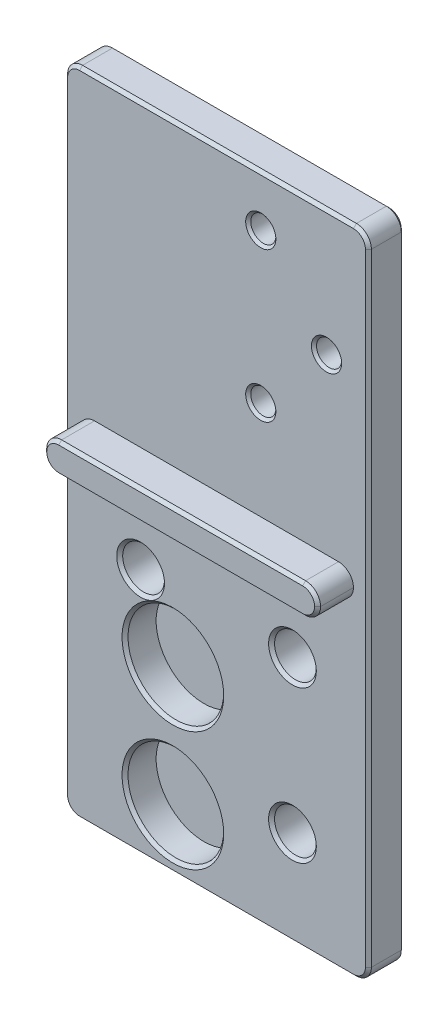
from build123d import *

# Parameters (mm, degrees)
MAIN_FEATURES_SKETCH_W         = 50.8
MAIN_FEATURES_SKETCH_H         = 109
MAIN_FEATURES_SKETCH_R         = 3.4925
MAIN_FEATURES_SKETCH_R_2       = 8
MAIN_BODY_DEPTH                = 6
SKETCH1_5_W                    = 45.8
SKETCH1_5_H                    = 5
LEDGE_DEPTH                    = 12
SKETCH1_4_R                    = 8
SCREW_HEAD_RECESSES_DEPTH      = 0.8
M5X0_8_TAPPED_HOLE1_AT_2_COUNT = 2
M5X0_8_TAPPED_HOLE1_AT_2_PITCH = 25
M5X0_8_TAPPED_HOLE1_AT_3_COUNT = 2
M5X0_8_TAPPED_HOLE1_AT_3_PITCH = 16.650825805
FILLET1_R                      = 2.5
CHAMFER1_SIZE                  = 0.5


with BuildPart() as part:
    # main_features_sketch → main_body (new body)
    with BuildSketch(Plane.XY):
        with Locations((0, -29.5)):
            Rectangle(MAIN_FEATURES_SKETCH_W, MAIN_FEATURES_SKETCH_H)
        with Locations((12.7, -42.7)):
            Circle(MAIN_FEATURES_SKETCH_R, mode=Mode.SUBTRACT)
        with Locations((12.7, -68.1)):
            Circle(MAIN_FEATURES_SKETCH_R, mode=Mode.SUBTRACT)
        with Locations((-7.3, -54)):
            Circle(MAIN_FEATURES_SKETCH_R_2, mode=Mode.SUBTRACT)
        with Locations((-7.3, -74)):
            Circle(MAIN_FEATURES_SKETCH_R_2, mode=Mode.SUBTRACT)
        with Locations((-12.7, -42.7)):
            Circle(MAIN_FEATURES_SKETCH_R, mode=Mode.SUBTRACT)
    extrude(amount=MAIN_BODY_DEPTH)

    # Sketch1<5> → ledge (add)
    with BuildSketch(Plane.XY):
        with Locations((0, -27.5)):
            Rectangle(SKETCH1_5_W, SKETCH1_5_H)
    extrude(amount=LEDGE_DEPTH)

    # Sketch1<4> → screw_head_recesses (add)
    with BuildSketch(Plane.XY):
        with Locations((-7.3, -54)):
            Circle(SKETCH1_4_R)
        with Locations((-7.3, -74)):
            Circle(SKETCH1_4_R)
    extrude(amount=SCREW_HEAD_RECESSES_DEPTH)

    # Sketch3 → M5x0.8 Tapped Hole1 (revolve, cut)
    with BuildSketch(Plane(origin=(7.4, -8.5, 6), x_dir=(0, -1, 0), z_dir=(1, 0, 0))):
        Polygon((0, 0), (0, 6), (2.525, 6), (2.1, 5.575), (2.1, 0.425), (2.525, 0), align=None)
    m5x0_8_tapped_hole1 = revolve(axis=Axis((7.4, -8.5, 12.35), (0, 0, -1)), mode=Mode.SUBTRACT)

    # M5x0.8 Tapped Hole1 at 2: M5x0.8 Tapped Hole1 ×2
    with Locations(*[(0, i * M5X0_8_TAPPED_HOLE1_AT_2_PITCH, 0) for i in range(1, M5X0_8_TAPPED_HOLE1_AT_2_COUNT)]):
        add(m5x0_8_tapped_hole1, mode=Mode.SUBTRACT)

    # M5x0.8 Tapped Hole1 at 3: M5x0.8 Tapped Hole1 ×2
    with Locations(*[Vector(0.6606278948920246, 0.7507135169227555, 0) * (i * M5X0_8_TAPPED_HOLE1_AT_3_PITCH) for i in range(1, M5X0_8_TAPPED_HOLE1_AT_3_COUNT)]):
        add(m5x0_8_tapped_hole1, mode=Mode.SUBTRACT)

    # Fillet1
    fillet1_edges = [part.edges().sort_by_distance(p)[0] for p in [
        (25.4, 25, 3),
        (-25.4, 25, 3),
        (25.4, -84, 3),
        (-25.4, -84, 3),
        (22.9, -25, 9),
        (22.9, -30, 9),
        (-22.9, -25, 9),
        (-22.9, -30, 9),
    ]]
    fillet(fillet1_edges, radius=FILLET1_R - 0.0001)  # a hair under: the kernel refuses the full size

    # Chamfer1
    chamfer1_edges = [part.edges().sort_by_distance(p)[0] for p in [
        (0, 25, 0),
        (-24.667796242, 24.267796242, 0),
        (24.667796242, 24.267796242, 0),
        (-24.667796242, -83.267796242, 0),
        (24.667796242, -83.267796242, 0),
        (0, -84, 6),
        (0, 25, 6),
        (-25.4, -29.5, 6),
        (-24.667796242, 24.267796242, 6),
        (24.667796242, 24.267796242, 6),
        (-24.667796242, -83.267796242, 6),
        (24.667796242, -83.267796242, 6),
        (-16.1925, -42.7, 0),
        (9.2075, -42.7, 0),
        (9.2075, -68.1, 0),
        (9.2075, -68.1, 6),
        (-15.3, -74, 6),
        (-15.3, -54, 6),
        (9.2075, -42.7, 6),
        (-16.1925, -42.7, 6),
        (0, -25, 12),
        (0, -30, 12),
        (-22.167796242, -29.267796242, 12),
        (-22.167796242, -25.732203758, 12),
        (22.167796242, -29.267796242, 12),
        (22.167796242, -25.732203758, 12),
        (25.4, -29.5, 0),
        (25.4, -29.5, 6),
        (0, -84, 0),
        (-25.4, -29.5, 0),
    ]]
    chamfer(chamfer1_edges, length=CHAMFER1_SIZE)


solid = part.part
